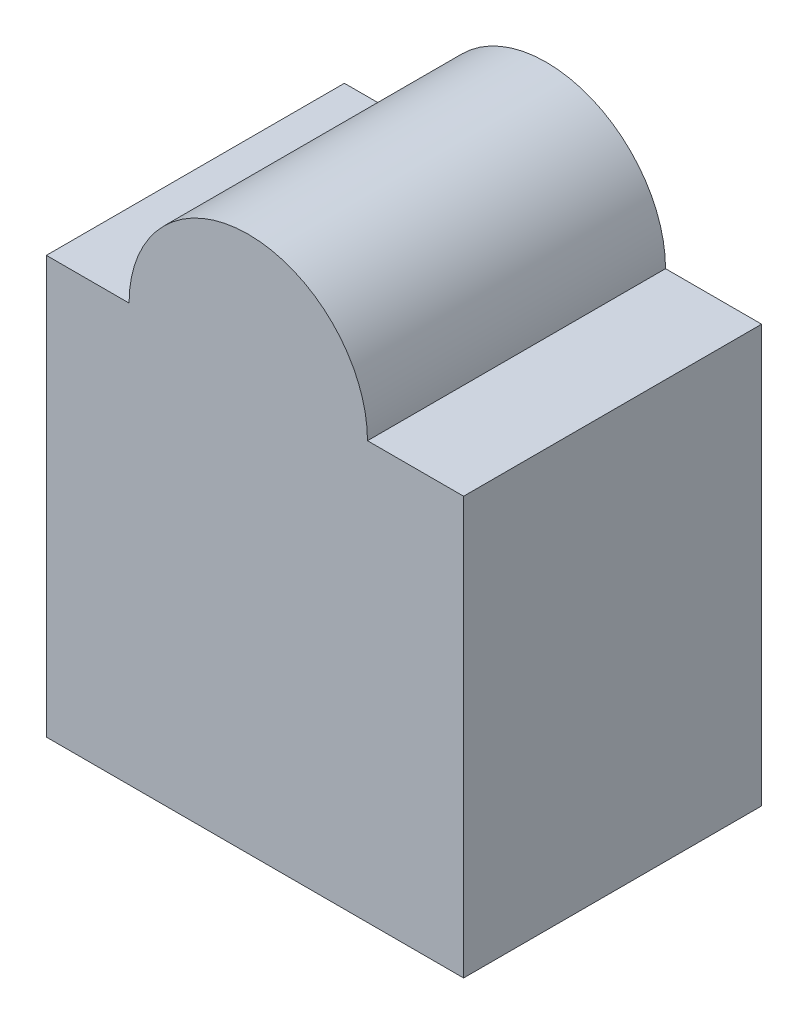
from build123d import *

# Parameters (mm, degrees)
BOSS_EXTRU_1_DEPTH = 500
ESQUISSE2_W        = 700
ESQUISSE2_H        = 500
BOSS_EXTRU_2_DEPTH = 250


with BuildPart() as part:
    # Esquisse1 → Boss.-Extru.1 (new body)
    with BuildSketch(Plane.XY):
        with BuildLine():
            Line((0, 0), (700, 0))
            Line((700, 0), (700, 450))
            Line((700, 450), (538.758062097, 450))
            ThreePointArc((538.758062097, 450), (338.758062097, 650), (138.758062097, 450))
            Line((138.758062097, 450), (0, 450))
            Line((0, 450), (0, 0))
        make_face()
    extrude(amount=BOSS_EXTRU_1_DEPTH)

    # Esquisse2 → Boss.-Extru.2 (add)
    with BuildSketch(Plane.XZ):
        with Locations((350, 250)):
            Rectangle(ESQUISSE2_W, ESQUISSE2_H)
    extrude(amount=BOSS_EXTRU_2_DEPTH)


solid = part.part
